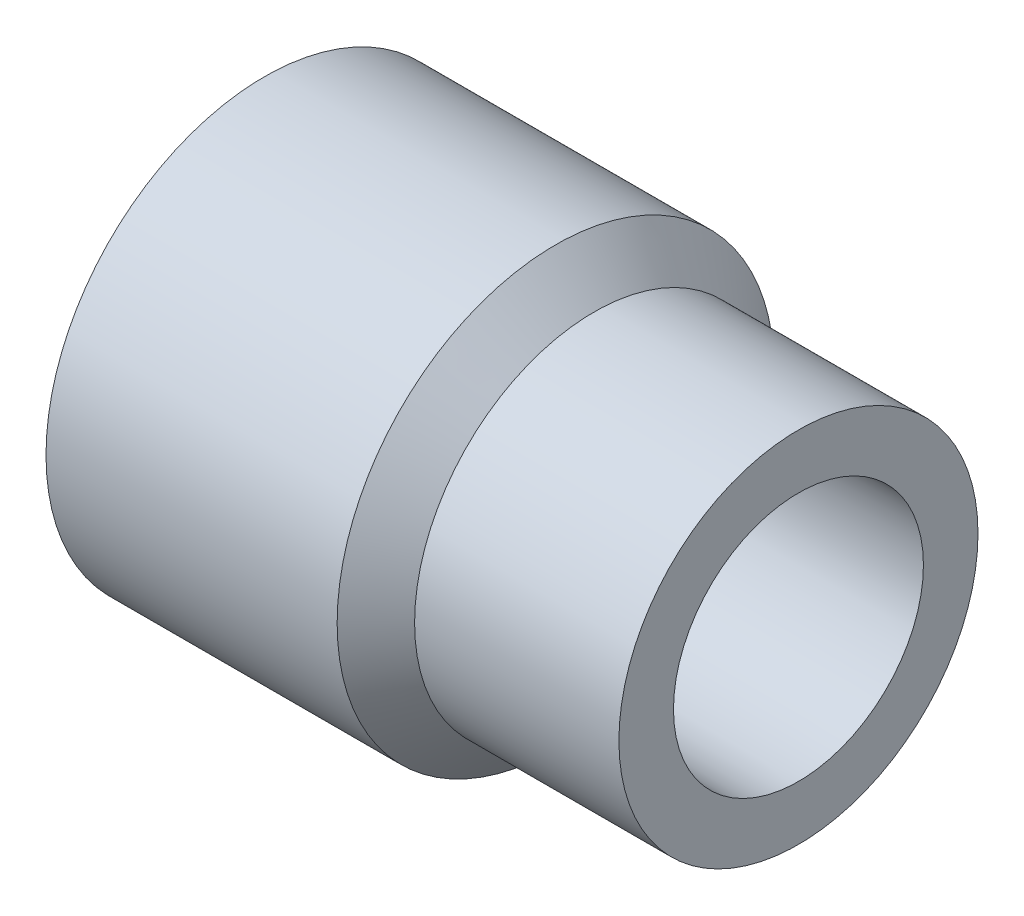
from build123d import *


with BuildPart() as part:
    # Sketch1 → Revolve1 (revolve)
    with BuildSketch(Plane.XY):
        Polygon((-28.702, -23.495), (-28.702, -16.8275), (0, -16.637), (2.069902004, -11.3538), (2.558951002, -11.3538), (3.048, -13.2842), (28.702, -13.4366), (28.702, -19.304), (6.735473471, -19.304), (2.599739405, -23.495), align=None)
    revolve(axis=Axis((-28.702, 0, 0), (1, 0, 0)))


solid = part.part
